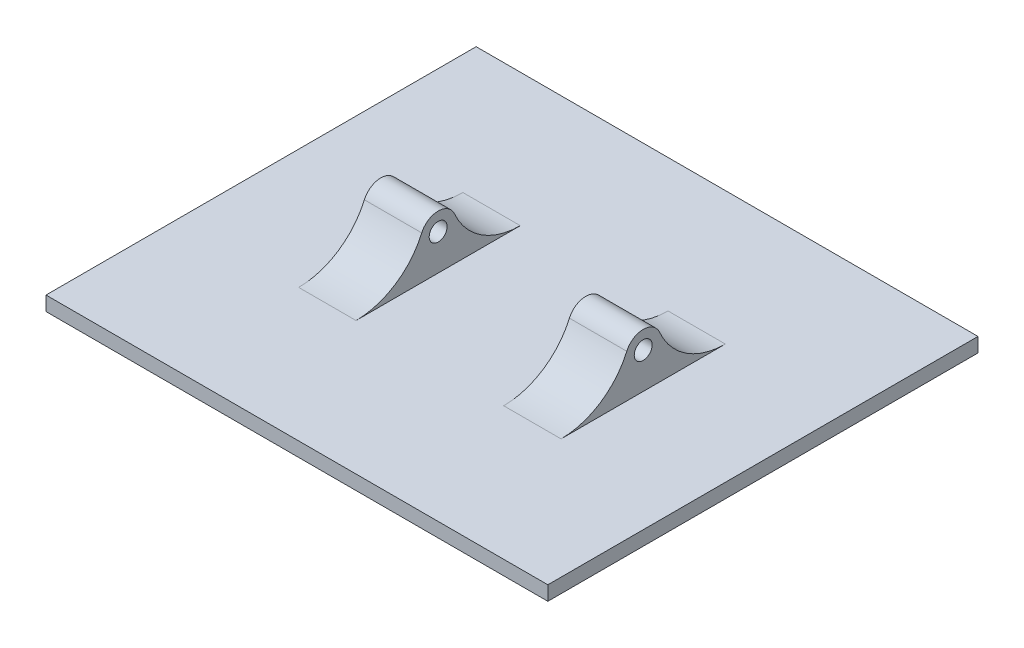
from build123d import *
from build123d.topology import SkipClean

# Parameters (mm, degrees)
SKETCH1_W           = 20
SKETCH1_H           = 60
BOSS_EXTRUDE1_DEPTH = 5
SKETCH2_R           = 2.5
SKETCH2_R_2         = 1.25
BOSS_EXTRUDE2_DEPTH = 20
CUT_EXTRUDE1_START  = -29
SKETCH3_R           = 1.25
CUT_EXTRUDE1_DEPTH  = 29
SKETCH4_R           = 2.5
SKETCH4_R_2         = 1.25
BOSS_EXTRUDE3_DEPTH = 20
CUT_EXTRUDE2_START  = -29
SKETCH5_R           = 1.25
CUT_EXTRUDE2_DEPTH  = 29
BOSS_EXTRUDE4_START = 70
SKETCH7_R           = 1.25
BOSS_EXTRUDE4_DEPTH = 70
SKETCH8_W           = 20.6
SKETCH8_H           = 18.256228475
SKETCH8_W_2         = 16.7
SKETCH8_H_2         = 28.46865204
SKETCH8_H_3         = 26.746757763
CUT_EXTRUDE4_DEPTH  = 84
SKETCH9_W           = 45.88716948
SKETCH9_H           = 69.445914147
CUT_EXTRUDE5_DEPTH  = 115
FILLET1_R           = 10


with BuildPart() as part:
    # Sketch1 → Boss-Extrude1 (new body)
    with BuildSketch(Plane.XY):
        with Locations((10, 30)):
            Rectangle(SKETCH1_W, SKETCH1_H)
    extrude(amount=BOSS_EXTRUDE1_DEPTH)

    # Sketch2 → Boss-Extrude2 (add)
    with BuildSketch(Plane(origin=(20, 0, 0), x_dir=(0, 0, -1), z_dir=(1, 0, 0))):
        with Locations((-2.5, 60)):
            Circle(SKETCH2_R)
        with Locations((-2.5, 60)):
            Circle(SKETCH2_R_2, mode=Mode.SUBTRACT)
    extrude(amount=-BOSS_EXTRUDE2_DEPTH)

    # Sketch3 → Cut-Extrude1 (cut)
    with SkipClean():  # the faces are left unmerged after this step: merging them gives an invalid solid
        with BuildSketch(Plane.ZY.offset(CUT_EXTRUDE1_START)):
            with Locations(Location((2.5, 60, 0), (0, 0, 180))):
                Circle(SKETCH3_R)
        extrude(amount=CUT_EXTRUDE1_DEPTH, mode=Mode.SUBTRACT)

    # Sketch4 → Boss-Extrude3 (add)
    with BuildSketch(Plane.ZY):
        with Locations((2.5, 0)):
            Circle(SKETCH4_R)
        with Locations((2.5, 0)):
            Circle(SKETCH4_R_2, mode=Mode.SUBTRACT)
    extrude(amount=-BOSS_EXTRUDE3_DEPTH)

    # Sketch5 → Cut-Extrude2 (cut)
    with SkipClean():  # the faces are left unmerged after this step: merging them gives an invalid solid
        with BuildSketch(Plane(origin=(20, 0, 0), x_dir=(0, 0, -1), z_dir=(1, 0, 0)).offset(CUT_EXTRUDE2_START)):
            with Locations(Location((-2.5, 0, 0), (0, 0, 180))):
                Circle(SKETCH5_R)
        extrude(amount=CUT_EXTRUDE2_DEPTH, mode=Mode.SUBTRACT)

    # Sketch7 → Boss-Extrude4 (add)
    # profile 1 of 2: a face of its own
    with SkipClean():  # the faces are left unmerged after this step: merging them gives an invalid solid
        with BuildSketch(Plane.ZY.offset(BOSS_EXTRUDE4_START)):
            with BuildLine():
                Line((0, -5), (-27.5, -5))
                Line((-27.5, -5), (-27.5, -7))
                Line((-27.5, -7), (32.5, -7))
                Line((32.5, -7), (32.5, -5))
                Line((32.5, -5), (5, -5))
                Line((5, -5), (5, 0))
                ThreePointArc((5, 0), (2.5, -2.5), (0, 0))
                Line((0, 0), (0, -5))
            make_face()
        # profile 2 of 2: a face of its own
        with BuildSketch(Plane.ZY.offset(BOSS_EXTRUDE4_START)):
            with BuildLine():
                ThreePointArc((5, 0), (2.5, 2.5), (0, 0))
                ThreePointArc((0, 0), (2.5, -2.5), (5, 0))
            make_face()
            with Locations((2.5, 0)):
                Circle(SKETCH7_R, mode=Mode.SUBTRACT)
        extrude(amount=-BOSS_EXTRUDE4_DEPTH)

    # Sketch8 → Cut-Extrude4 (cut)
    with SkipClean():  # the faces are left unmerged after this step: merging them gives an invalid solid
        with BuildSketch(Plane(origin=(0, -5, 0), x_dir=(1, 0, 0), z_dir=(0, 1, 0))):
            with Locations((-35, -1.601019052)):
                Rectangle(SKETCH8_W, SKETCH8_H)
            with Locations((-8.35, -2.689028032)):
                Rectangle(SKETCH8_W_2, SKETCH8_H_2)
            with Locations((-61.65, -3.54997517)):
                Rectangle(SKETCH8_W_2, SKETCH8_H_3)
        extrude(amount=CUT_EXTRUDE4_DEPTH, mode=Mode.SUBTRACT)


with BuildPart() as cut_extrude4_piece_1:
    # of the separate pieces the step leaves, piece 1, a body of its own (cut_extrude4_pieces)
    add(part.part.solids().sort_by_distance((0, -5, 0))[0])

    # Fillet1
    # the kernel refuses this fillet: 10 mm, written as the material it adds along each edge
    with BuildSketch(Plane(origin=(-47.091098093, -5, 5), x_dir=(0, 0, 1), z_dir=(1, 0, 0))) as fillet1_piece_1_section:
        with BuildLine():
            CenterArc((8.956439237, -10), FILLET1_R, 90, 66.421821522)
            Line((-0.208712153, -6), (-1.125227292, -5.6))
            ThreePointArc((-1.125227292, -5.6), (-1, -5), (-1, 0))
            Line((-1, 0), (0, 1))
            Line((0, 1), (8.956439237, 1))
            Line((8.956439237, 1), (8.956439237, 0))
        make_face()
    fillet1_piece_1 = extrude(amount=30.391098093, mode=Mode.PRIVATE)
    fillet1_piece_1 = split(fillet1_piece_1, bisect_by=Plane(origin=(-45.3, -3.872690531, 7.347841943), z_dir=(-1, 0, 0)), keep=Keep.TOP, mode=Mode.PRIVATE)
    add(fillet1_piece_1)
    with BuildSketch(Plane(origin=(-24.7, -5, 5), x_dir=(0, 0, 1), z_dir=(1, 0, 0)), Plane(origin=(-53.3, -5, 5), x_dir=(0, 0, 1), z_dir=(1, 0, 0))) as fillet1_piece_2:
        with BuildLine():
            CenterArc((8.956439237, -10), FILLET1_R, 90, 66.421821522)
            Line((-0.208712153, -6), (-1.125227292, -5.6))
            ThreePointArc((-1.125227292, -5.6), (-1, -5), (-1, 0))
            Line((-1, 0), (0, 1))
            Line((0, 1), (8.956439237, 1))
            Line((8.956439237, 1), (8.956439237, 0))
        make_face()
    extrude(amount=8)
    with BuildSketch(Plane(origin=(-53.3, -5, 5), x_dir=(0, 0, 1), z_dir=(1, 0, 0))) as fillet1_piece_3_section:
        with BuildLine():
            CenterArc((8.956439237, -10), FILLET1_R, 90, 66.421821522)
            Line((-0.208712153, -6), (-1.125227292, -5.6))
            ThreePointArc((-1.125227292, -5.6), (-1, -5), (-1, 0))
            Line((-1, 0), (0, 1))
            Line((0, 1), (8.956439237, 1))
            Line((8.956439237, 1), (8.956439237, 0))
        make_face()
    fillet1_piece_3 = extrude(amount=30.391098093, mode=Mode.PRIVATE)
    fillet1_piece_3 = split(fillet1_piece_3, bisect_by=Plane(origin=(-24.7, -3.872690531, 7.347841943), z_dir=(1, 0, 0)), keep=Keep.TOP, mode=Mode.PRIVATE)
    add(fillet1_piece_3)
    with BuildSketch(Plane(origin=(-53.3, -5, 0), x_dir=(0, 0, -1), z_dir=(1, 0, 0)), Plane(origin=(-24.7, -5, 0), x_dir=(0, 0, -1), z_dir=(1, 0, 0))) as fillet1_piece_4:
        with BuildLine():
            CenterArc((8.956439237, 10), FILLET1_R, 203.578178478, 66.421821522)
            Line((-0.208712153, 6), (-1.125227292, 5.6))
            ThreePointArc((-1.125227292, 5.6), (-1, 5), (-1, 0))
            Line((-1, 0), (0, -1))
            Line((0, -1), (8.956439237, -1))
            Line((8.956439237, -1), (8.956439237, 0))
        make_face()
    extrude(amount=8)
    with BuildSketch(Plane(origin=(-53.3, -5, 0), x_dir=(0, 0, -1), z_dir=(1, 0, 0))) as fillet1_piece_5_section:
        with BuildLine():
            CenterArc((8.956439237, 10), FILLET1_R, 203.578178478, 66.421821522)
            Line((-0.208712153, 6), (-1.125227292, 5.6))
            ThreePointArc((-1.125227292, 5.6), (-1, 5), (-1, 0))
            Line((-1, 0), (0, -1))
            Line((0, -1), (8.956439237, -1))
            Line((8.956439237, -1), (8.956439237, 0))
        make_face()
    fillet1_piece_5 = extrude(amount=30.391098093, mode=Mode.PRIVATE)
    fillet1_piece_5 = split(fillet1_piece_5, bisect_by=Plane(origin=(-24.7, -3.872690531, -2.347841943), z_dir=(1, 0, 0)), keep=Keep.TOP, mode=Mode.PRIVATE)
    add(fillet1_piece_5)
    with BuildSketch(Plane(origin=(-47.091098093, -5, 0), x_dir=(0, 0, -1), z_dir=(1, 0, 0))) as fillet1_piece_6_section:
        with BuildLine():
            CenterArc((8.956439237, 10), FILLET1_R, 203.578178478, 66.421821522)
            Line((-0.208712153, 6), (-1.125227292, 5.6))
            ThreePointArc((-1.125227292, 5.6), (-1, 5), (-1, 0))
            Line((-1, 0), (0, -1))
            Line((0, -1), (8.956439237, -1))
            Line((8.956439237, -1), (8.956439237, 0))
        make_face()
    fillet1_piece_6 = extrude(amount=30.391098093, mode=Mode.PRIVATE)
    fillet1_piece_6 = split(fillet1_piece_6, bisect_by=Plane(origin=(-45.3, -3.872690531, -2.347841943), z_dir=(-1, 0, 0)), keep=Keep.TOP, mode=Mode.PRIVATE)
    add(fillet1_piece_6)


with BuildPart() as cut_extrude4_piece_2:
    # of the separate pieces the step leaves, piece 2, a body of its own (cut_extrude4_pieces)
    add(part.part.solids().sort_by_distance((20, 0, 0))[0])

    # Sketch9 → Cut-Extrude5 (cut)
    with BuildSketch(Plane(origin=(-16.7, 0, 0), x_dir=(0, 0, -1), z_dir=(1, 0, 0))):
        with Locations((-3.398393378, 29.722957074)):
            Rectangle(SKETCH9_W, SKETCH9_H)
    extrude(amount=CUT_EXTRUDE5_DEPTH, mode=Mode.SUBTRACT)


solid = cut_extrude4_piece_1.part
